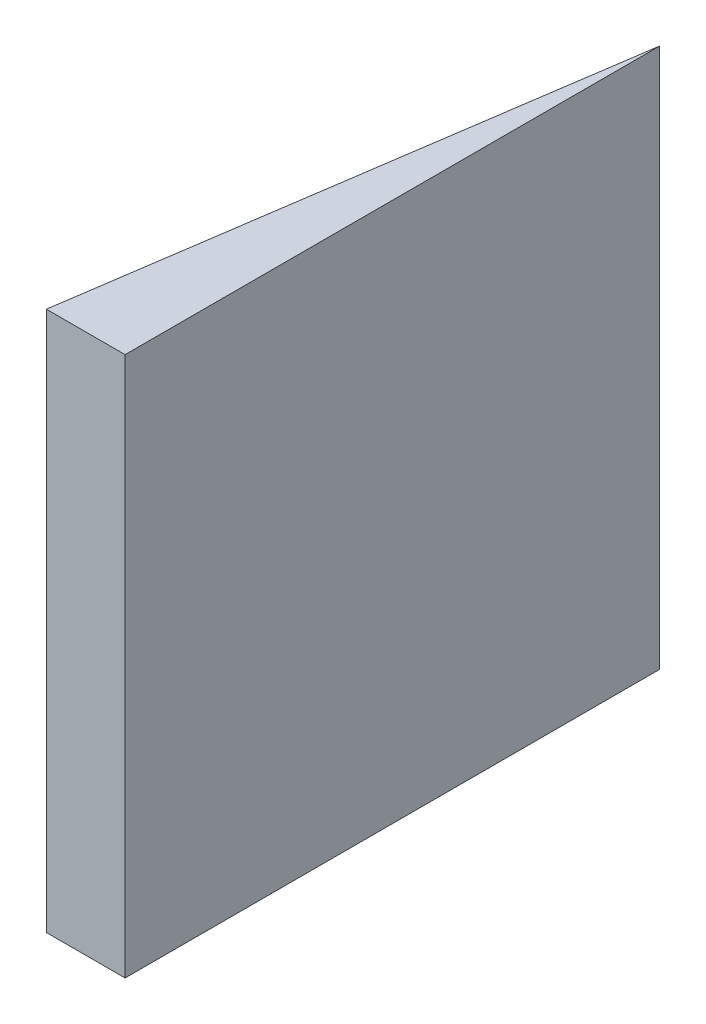
from build123d import *

# Parameters (mm, degrees)
BOSS_EXTRUDE1_DEPTH = 609.6
SHELL1_T            = -5.08


with BuildPart() as part:
    # Sketch1 → Boss-Extrude1 (new body)
    with BuildSketch(Plane(origin=(0, 0, 0), x_dir=(1, 0, 0), z_dir=(0, 1, 0))):
        Polygon((88.9, 603.59635657), (0, 0), (88.9, 0), align=None)
    extrude(amount=BOSS_EXTRUDE1_DEPTH)

    # Shell1
    shell1_openings = [part.faces().sort_by_distance(p)[0] for p in [
        (44.45, 304.8, -301.798178285),
    ]]
    offset(amount=SHELL1_T, openings=shell1_openings, kind=Kind.INTERSECTION)


solid = part.part
